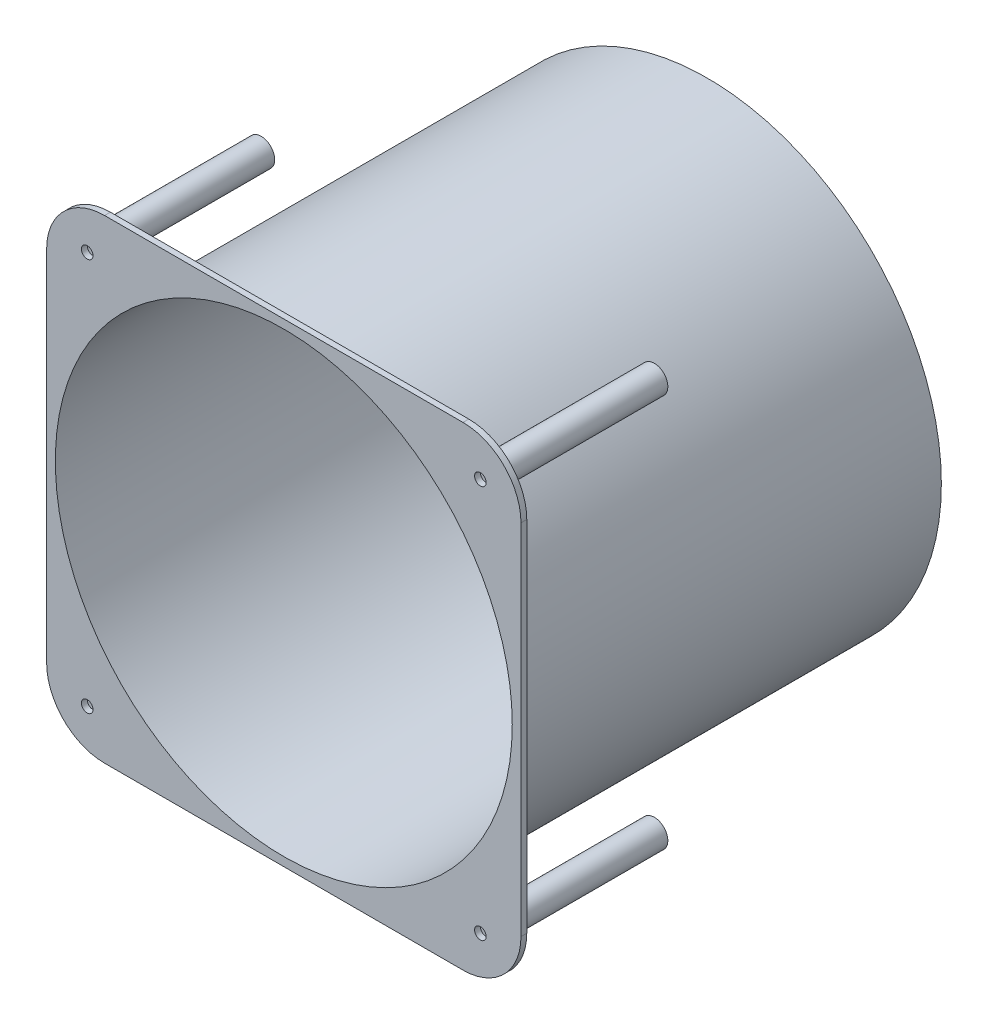
from build123d import *

# Parameters (mm, degrees)
SKETCH1_R           = 51.308
BOSS_EXTRUDE1_DEPTH = 92.71
SKETCH2_W           = 103.886
SKETCH2_H           = 103.886
SKETCH2_R           = 1.27
BOSS_EXTRUDE2_DEPTH = 1.27
SHELL1_START        = -92.71
SHELL1_OUTLINE_R    = 50.038
SHELL1_DEPTH        = 92.71
FILLET1_R           = 12.7
SKETCH3_R           = 2.9591
BOSS_EXTRUDE3_DEPTH = 36.83


# Read off the part's stored shape, not the designer's step: Shell1
with BuildPart() as part:
    # Sketch1 → Boss-Extrude1 (new body)
    with BuildSketch(Plane.XY):
        Circle(SKETCH1_R)
    extrude(amount=-BOSS_EXTRUDE1_DEPTH)

    # Sketch2 → Boss-Extrude2 (add)
    with BuildSketch(Plane.XY):
        Rectangle(SKETCH2_W, SKETCH2_H)
        with Locations((43.053, 43.053)):
            Circle(SKETCH2_R, mode=Mode.SUBTRACT)
        with Locations((-43.053, 43.053)):
            Circle(SKETCH2_R, mode=Mode.SUBTRACT)
        with Locations((43.053, -43.053)):
            Circle(SKETCH2_R, mode=Mode.SUBTRACT)
        with Locations((-43.053, -43.053)):
            Circle(SKETCH2_R, mode=Mode.SUBTRACT)
    extrude(amount=-BOSS_EXTRUDE2_DEPTH)

    # Shell1 outline → Shell1 (cut)
    with BuildSketch(Plane.XY.offset(SHELL1_START)):
        Circle(SHELL1_OUTLINE_R)
    extrude(amount=SHELL1_DEPTH, mode=Mode.SUBTRACT)

    # Fillet1
    fillet1_edges = [part.edges().sort_by_distance(p)[0] for p in [
        (51.943, 51.943, -0.635),
        (51.943, -51.943, -0.635),
        (-51.943, -51.943, -0.635),
        (-51.943, 51.943, -0.635),
    ]]
    fillet(fillet1_edges, radius=FILLET1_R)

    # Sketch3 → Boss-Extrude3 (add)
    with BuildSketch(Plane(origin=(0, 0, -1.27), x_dir=(-1, 0, 0), z_dir=(0, 0, -1))):
        with Locations((-43.053, 43.053)):
            Circle(SKETCH3_R)
        with Locations((43.053, 43.053)):
            Circle(SKETCH3_R)
        with Locations((43.053, -43.053)):
            Circle(SKETCH3_R)
        with Locations((-43.053, -43.053)):
            Circle(SKETCH3_R)
    extrude(amount=BOSS_EXTRUDE3_DEPTH)


solid = part.part
